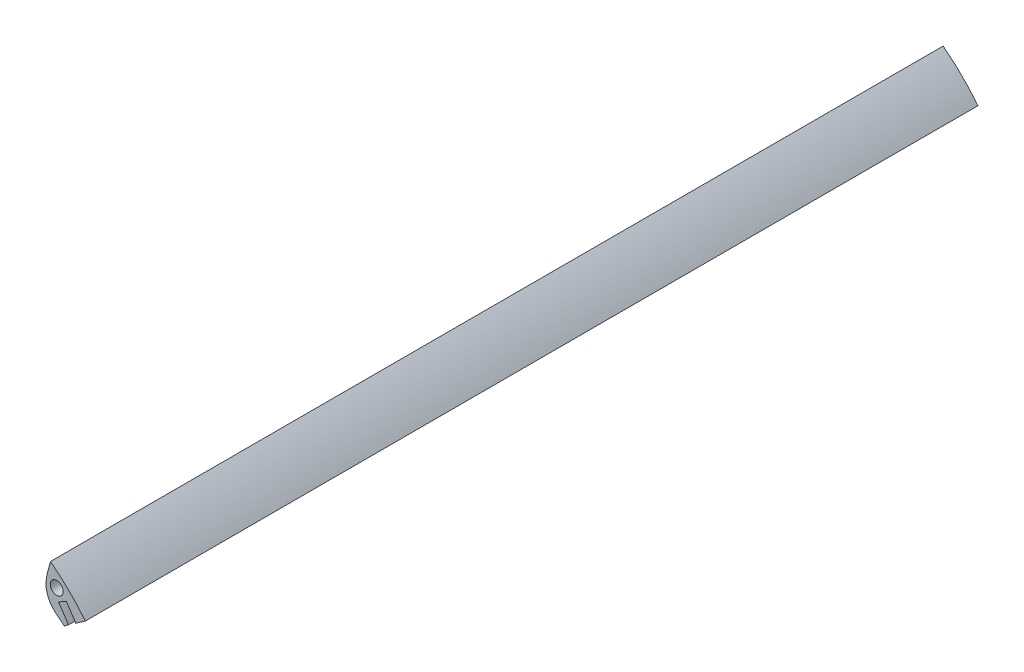
from build123d import *

# Parameters (mm, degrees)
EXTRUDE_1_DEPTH     = 200
SKETCH_2_R          = 1.45
CUT_EXTRUDE_1_DEPTH = 207.188353614
CUT_EXTRUDE_2_DEPTH = 207.188353614
FILLET_1_R          = 10
CHAMFER_START       = 36
CHAMFER_1_OUTLINE_W = 8
CHAMFER_1_OUTLINE_H = 200
CHAMFER_1_DEPTH     = 2.349513284
FILLET_2_R          = 6


with BuildPart() as part:
    # Эскиз1 → Бобышка-Вытянуть1 (new body)
    with BuildSketch(Plane.XY):
        with BuildLine():
            Line((25.256912811, 27.718916921), (27.395437576, 35.7))
            ThreePointArc((27.395437576, 35.7), (31.532369241, 32.10466773), (35.201522214, 28.033066792))
            Line((35.201522214, 28.033066792), (29.04384005, 23.721411323))
            ThreePointArc((29.04384005, 23.721411323), (27.223848976, 25.789766322), (25.256912811, 27.718916921))
        make_face()
    extrude(amount=EXTRUDE_1_DEPTH)

    # Эскиз2 → Вырез-Вытянуть1 (cut, through all)
    with BuildSketch(Plane.XY.offset(200)):
        with Locations((28.793836633, 31.259638065)):
            Circle(SKETCH_2_R)
    extrude(amount=-CUT_EXTRUDE_1_DEPTH, mode=Mode.SUBTRACT)

    # Эскиз4 → Вырез-Вытянуть2 (cut, through all)
    with BuildSketch(Plane.XY.offset(200)):
        with BuildLine():
            Line((29.156742817, 28.750319078), (30.957117515, 29.673853967))
            ThreePointArc((30.957117515, 29.673853967), (32.031639738, 28.118803021), (33.047614071, 26.524884074))
            Line((33.047614071, 26.524884074), (31.406028194, 25.375433268))
            ThreePointArc((31.406028194, 25.375433268), (30.316432625, 27.086234289), (29.156742817, 28.750319078))
        make_face()
    extrude(amount=-CUT_EXTRUDE_2_DEPTH, mode=Mode.SUBTRACT)

    # Скругление1
    fillet_1_edges = [part.edges().sort_by_distance(p)[0] for p in [
        (25.256912811, 27.718916921, 100),
    ]]
    fillet(fillet_1_edges, radius=FILLET_1_R)

    # Фаска1: read off the stored shape, not the designer's step
    # Фаска1 outline → Фаска1 (cut)
    with BuildSketch(Plane(origin=(0, 0, 0), x_dir=(0.7805652874719331, -0.6250742611833081, 0), z_dir=(0.6250742611833081, 0.7805652874719331, 0)).offset(CHAMFER_START)):
        with Locations((6, -100)):
            Rectangle(CHAMFER_1_OUTLINE_W, CHAMFER_1_OUTLINE_H)
    extrude(amount=CHAMFER_1_DEPTH, mode=Mode.SUBTRACT)

    # Скругление2
    fillet_2_edges = [part.edges().sort_by_distance(p)[0] for p in [
        (26.792531546, 27.67506033, 100),
    ]]
    fillet(fillet_2_edges, radius=FILLET_2_R)


solid = part.part
